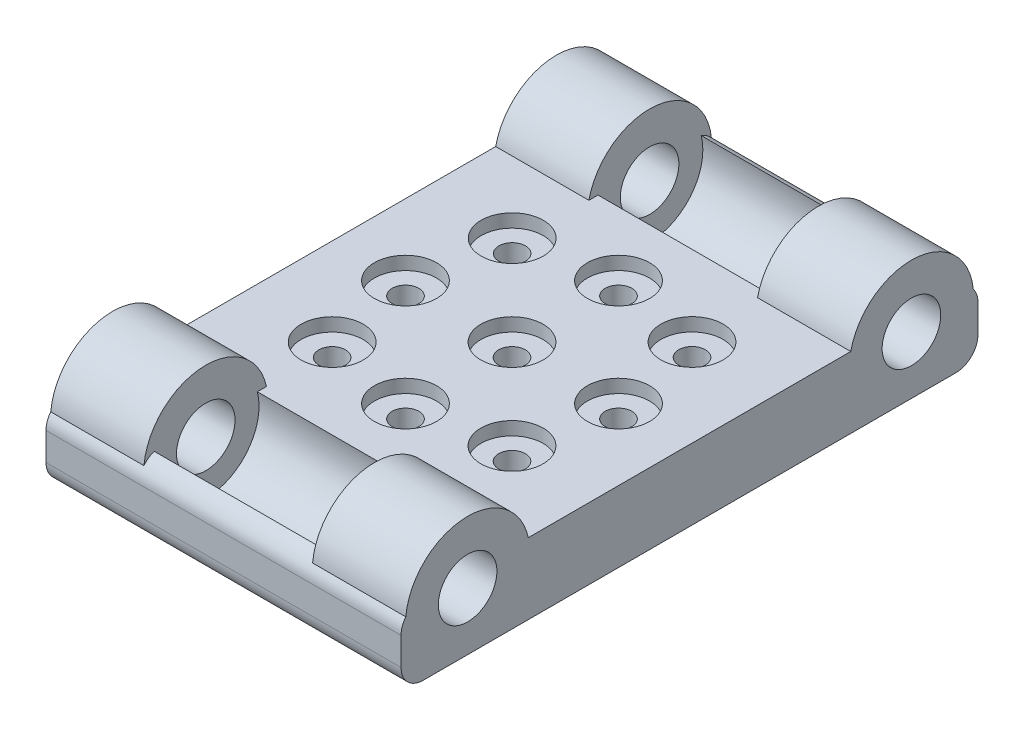
from build123d import *

# Parameters (mm, degrees)
SKETCH_1_W          = 40
SKETCH_1_H          = 65
EXTRUDE_1_DEPTH     = 8
SKETCH_5_R          = 6
CUT_EXTRUDE_2_DEPTH = 44
SKETCH_6_R          = 3.3
EXTRUDE_2_DEPTH     = 10.5
EXTRUDE_START       = -10.5
SKETCH_7_R          = 3.3
EXTRUDE_3_DEPTH     = 10.5
SKETCH_8_R          = 1.5
CUT_EXTRUDE_3_DEPTH = 10.5
FILLET_1_R          = 2.5
SKETCH_10_R         = 3
EXTRUDE_4_DEPTH     = 1
CHAMFER_1_SIZE      = 1.5
CHAMFER_1_SIZE_2    = 0.5
SKETCH_11_R         = 1.5
CUT_EXTRUDE_4_DEPTH = 22.5
SKETCH_12_R         = 3.5
CUT_EXTRUDE_5_DEPTH = 1.5


with BuildPart() as part:
    # 草图1 → 凸台-拉伸1 (new body)
    with BuildSketch(Plane(origin=(0, 0, 0), x_dir=(1, 0, 0), z_dir=(0, 1, 0))):
        with Locations((-1.467181467, -6.013513514)):
            Rectangle(SKETCH_1_W, SKETCH_1_H)
    extrude(amount=EXTRUDE_1_DEPTH)

    # 草图5 → 切除-拉伸2 (cut)
    with BuildSketch(Plane(origin=(18.532818533, 0, 0), x_dir=(0, 0, -1), z_dir=(1, 0, 0))):
        with Locations((18.986486486, 6.5)):
            Circle(SKETCH_5_R)
        with Locations((-31.013513514, 6.5)):
            Circle(SKETCH_5_R)
    extrude(amount=-CUT_EXTRUDE_2_DEPTH, mode=Mode.SUBTRACT)

    # 草图6 → 凸台-拉伸2 (add)
    # profile 1 of 3: a face of its own
    with BuildSketch(Plane(origin=(18.532818533, 0, 0), x_dir=(0, 0, -1), z_dir=(1, 0, 0))):
        with BuildLine():
            Line((16.388410275, 0), (21.584562698, 0))
            ThreePointArc((21.584562698, 0), (24.782456357, 2.574858823), (25.986486486, 6.5))
            ThreePointArc((25.986486486, 6.5), (25.945717053, 7.254393744), (25.823883652, 8))
            Line((25.823883652, 8), (24.795961506, 8))
            ThreePointArc((24.795961506, 8), (18.986486486, 0.5), (13.177011467, 8))
            Line((13.177011467, 8), (12.149089321, 8))
            ThreePointArc((12.149089321, 8), (12.801258967, 3.222354422), (16.388410275, 0))
        make_face()
    # profile 2 of 3: a face of its own
    with BuildSketch(Plane(origin=(18.532818533, 0, 0), x_dir=(0, 0, -1), z_dir=(1, 0, 0))):
        with BuildLine():
            ThreePointArc((25.823883652, 8), (18.986486486, 13.5), (12.149089321, 8))
            Line((12.149089321, 8), (13.177011467, 8))
            ThreePointArc((13.177011467, 8), (18.986486486, 0.5), (24.795961506, 8))
            Line((24.795961506, 8), (25.823883652, 8))
        make_face()
        with Locations((18.986486486, 6.5)):
            Circle(SKETCH_6_R, mode=Mode.SUBTRACT)
    # profile 3 of 3: a face of its own
    with BuildSketch(Plane(origin=(18.532818533, 0, 0), x_dir=(0, 0, -1), z_dir=(1, 0, 0))):
        with BuildLine():
            Line((-25.204038494, 8), (-24.176116348, 8))
            ThreePointArc((-24.176116348, 8), (-31.013513514, 13.5), (-37.850910679, 8))
            Line((-37.850910679, 8), (-36.822988533, 8))
            ThreePointArc((-36.822988533, 8), (-31.013513514, 0.5), (-25.204038494, 8))
        make_face()
        with Locations((-31.013513514, 6.5)):
            Circle(SKETCH_6_R, mode=Mode.SUBTRACT)
    extrude(amount=-EXTRUDE_2_DEPTH)

    # 草图7 → 凸台-拉伸3 (add)
    # profile 1 of 5: a face of its own
    with BuildSketch(Plane.ZY.offset(21.467181467).offset(EXTRUDE_START)):
        with BuildLine():
            ThreePointArc((37.850910679, 8), (31.013513514, 13.5), (24.176116348, 8))
            Line((24.176116348, 8), (25.204038494, 8))
            ThreePointArc((25.204038494, 8), (31.013513514, 0.5), (36.822988533, 8))
            Line((36.822988533, 8), (37.850910679, 8))
        make_face()
        with Locations(Location((31.013513514, 6.5, 0), (0, 0, 180))):
            Circle(SKETCH_7_R, mode=Mode.SUBTRACT)
    # profile 2 of 5: a face of its own
    with BuildSketch(Plane.ZY.offset(21.467181467).offset(EXTRUDE_START)):
        with BuildLine():
            Line((28.415437302, 0), (33.611589725, 0))
            ThreePointArc((33.611589725, 0), (36.809483384, 2.574858823), (38.013513514, 6.5))
            ThreePointArc((38.013513514, 6.5), (37.97274408, 7.254393744), (37.850910679, 8))
            Line((37.850910679, 8), (36.822988533, 8))
            ThreePointArc((36.822988533, 8), (31.013513514, 0.5), (25.204038494, 8))
            Line((25.204038494, 8), (24.176116348, 8))
            ThreePointArc((24.176116348, 8), (24.828285995, 3.222354422), (28.415437302, 0))
        make_face()
    # profile 3 of 5: a face of its own
    with BuildSketch(Plane.ZY.offset(21.467181467).offset(EXTRUDE_START)):
        with BuildLine():
            Line((-21.584562698, 0), (-16.388410275, 0))
            ThreePointArc((-16.388410275, 0), (-13.190516616, 2.574858823), (-11.986486486, 6.5))
            ThreePointArc((-11.986486486, 6.5), (-12.02725592, 7.254393744), (-12.149089321, 8))
            Line((-12.149089321, 8), (-13.177011467, 8))
            ThreePointArc((-13.177011467, 8), (-13.034308309, 7.256025755), (-12.986486486, 6.5))
            ThreePointArc((-12.986486486, 6.5), (-19.742512241, 0.547821822), (-24.795961506, 8))
            Line((-24.795961506, 8), (-25.823883652, 8))
            ThreePointArc((-25.823883652, 8), (-25.171714005, 3.222354422), (-21.584562698, 0))
        make_face()
    # profile 4 of 5: a face of its own
    with BuildSketch(Plane.ZY.offset(21.467181467).offset(EXTRUDE_START)):
        with BuildLine():
            ThreePointArc((-12.986486486, 6.5), (-13.034308309, 7.256025755), (-13.177011467, 8))
            ThreePointArc((-13.177011467, 8), (-18.986486486, 12.5), (-24.795961506, 8))
            ThreePointArc((-24.795961506, 8), (-19.742512241, 0.547821822), (-12.986486486, 6.5))
        make_face()
        with Locations(Location((-18.986486486, 6.5, 0), (0, 0, 180))):
            Circle(SKETCH_7_R, mode=Mode.SUBTRACT)
    # profile 5 of 5: a face of its own
    with BuildSketch(Plane.ZY.offset(21.467181467).offset(EXTRUDE_START)):
        with BuildLine():
            Line((-13.177011467, 8), (-12.149089321, 8))
            ThreePointArc((-12.149089321, 8), (-18.986486486, 13.5), (-25.823883652, 8))
            Line((-25.823883652, 8), (-24.795961506, 8))
            ThreePointArc((-24.795961506, 8), (-18.986486486, 12.5), (-13.177011467, 8))
        make_face()
    extrude(amount=EXTRUDE_3_DEPTH)

    # 草图8 → 切除-拉伸3 (cut)
    with BuildSketch(Plane.XZ):
        with Locations(Location((-1.467181467, 6.013513514, 0), (0, 0, 270))):
            Circle(SKETCH_8_R)
        with Locations(Location((-13.467181467, 6.013513514, 0), (0, 0, 270))):
            Circle(SKETCH_8_R)
        with Locations(Location((-1.467181467, 18.013513514, 0), (0, 0, 270))):
            Circle(SKETCH_8_R)
        with Locations(Location((10.532818533, 6.013513514, 0), (0, 0, 270))):
            Circle(SKETCH_8_R)
        with Locations(Location((-1.467181467, -5.986486486, 0), (0, 0, 270))):
            Circle(SKETCH_8_R)
    extrude(amount=-CUT_EXTRUDE_3_DEPTH, mode=Mode.SUBTRACT)

    # 圆角1
    # the kernel refuses this fillet: 2.5 mm, written as the material it takes off along each edge
    with BuildSketch(Plane(origin=(24.446124605, 8, 38.513513514), x_dir=(0, -1, 0), z_dir=(-1, 0, 0))) as fillet_1_piece_1_section:
        with BuildLine():
            CenterArc((2.365322429, -2.5), FILLET_1_R, 90, 71.107715915)
            Line((0, -1.690524981), (-0.047306449, -1.67433548))
            ThreePointArc((-0.047306449, -1.67433548), (-0.05, -0.84526249), (-0.05, 0))
            Line((-0.05, 0), (0, 0.05))
            Line((0, 0.05), (2.365322429, 0.05))
            Line((2.365322429, 0.05), (2.365322429, 0))
        make_face()
    fillet_1_piece_1 = extrude(amount=51.826612145, mode=Mode.PRIVATE)
    fillet_1_piece_1 = fillet_1_piece_1 - Plane(origin=(16.239471569, 6.5, 31.013513514), x_dir=(0, 0.21428571428570323, -0.976771023655527), z_dir=(1, 0, 0)) * Cylinder(7, 114, mode=Mode.PRIVATE)
    fillet_1_piece_1 = split(fillet_1_piece_1, bisect_by=Plane(origin=(8.032818533, 7.283309806, 38.299348366), z_dir=(1, 0, 0)), keep=Keep.TOP, mode=Mode.PRIVATE)
    add(fillet_1_piece_1, mode=Mode.SUBTRACT)
    with BuildSketch(Plane(origin=(24.446124605, 8, 38.513513514), x_dir=(0, -1, 0), z_dir=(-1, 0, 0))) as fillet_1_piece_2_section:
        with BuildLine():
            CenterArc((2.365322429, -2.5), FILLET_1_R, 90, 71.107715915)
            Line((0, -1.690524981), (-0.047306449, -1.67433548))
            ThreePointArc((-0.047306449, -1.67433548), (-0.05, -0.84526249), (-0.05, 0))
            Line((-0.05, 0), (0, 0.05))
            Line((0, 0.05), (2.365322429, 0.05))
            Line((2.365322429, 0.05), (2.365322429, 0))
        make_face()
    fillet_1_piece_2 = extrude(amount=51.826612145, mode=Mode.PRIVATE)
    fillet_1_piece_2 = fillet_1_piece_2 - Plane(origin=(-1.467181467, 6.5, 31.013513514), x_dir=(0, 0.21428571428570323, -0.976771023655527), z_dir=(1, 0, 0)) * Cylinder(7, 114, mode=Mode.PRIVATE)
    fillet_1_piece_2 = split(fillet_1_piece_2, bisect_by=Plane(origin=(8.032818533, 7.283309806, 38.299348366), z_dir=(-1, 0, 0)), keep=Keep.TOP, mode=Mode.PRIVATE)
    fillet_1_piece_2 = split(fillet_1_piece_2, bisect_by=Plane(origin=(-10.967181467, 7.283309806, 38.299348366), z_dir=(1, 0, 0)), keep=Keep.TOP, mode=Mode.PRIVATE)
    add(fillet_1_piece_2, mode=Mode.SUBTRACT)
    with BuildSketch(Plane(origin=(24.446124605, 8, 38.513513514), x_dir=(0, -1, 0), z_dir=(-1, 0, 0))) as fillet_1_piece_3_section:
        with BuildLine():
            CenterArc((2.365322429, -2.5), FILLET_1_R, 90, 71.107715915)
            Line((0, -1.690524981), (-0.047306449, -1.67433548))
            ThreePointArc((-0.047306449, -1.67433548), (-0.05, -0.84526249), (-0.05, 0))
            Line((-0.05, 0), (0, 0.05))
            Line((0, 0.05), (2.365322429, 0.05))
            Line((2.365322429, 0.05), (2.365322429, 0))
        make_face()
    fillet_1_piece_3 = extrude(amount=51.826612145, mode=Mode.PRIVATE)
    fillet_1_piece_3 = fillet_1_piece_3 & Plane(origin=(-1.467181467, 6.5, 31.013513514), x_dir=(0, 0.21428571428570323, -0.976771023655527), z_dir=(1, 0, 0)) * Cylinder(7, 114, mode=Mode.PRIVATE)
    fillet_1_piece_3 = split(fillet_1_piece_3, bisect_by=Plane(origin=(8.032818533, 7.788886654, 37.563279278), z_dir=(-1, 0, 0)), keep=Keep.TOP, mode=Mode.PRIVATE)
    fillet_1_piece_3 = split(fillet_1_piece_3, bisect_by=Plane(origin=(-10.967181467, 7.788886654, 37.563279278), z_dir=(1, 0, 0)), keep=Keep.TOP, mode=Mode.PRIVATE)
    add(fillet_1_piece_3, mode=Mode.SUBTRACT)
    with BuildSketch(Plane(origin=(24.446124605, 8, 38.513513514), x_dir=(0, -1, 0), z_dir=(-1, 0, 0))) as fillet_1_piece_4_section:
        with BuildLine():
            CenterArc((2.365322429, -2.5), FILLET_1_R, 90, 71.107715915)
            Line((0, -1.690524981), (-0.047306449, -1.67433548))
            ThreePointArc((-0.047306449, -1.67433548), (-0.05, -0.84526249), (-0.05, 0))
            Line((-0.05, 0), (0, 0.05))
            Line((0, 0.05), (2.365322429, 0.05))
            Line((2.365322429, 0.05), (2.365322429, 0))
        make_face()
    fillet_1_piece_4 = extrude(amount=51.826612145, mode=Mode.PRIVATE)
    fillet_1_piece_4 = fillet_1_piece_4 - Plane(origin=(-19.173834503, 6.5, 31.013513514), x_dir=(0, 0.21428571428570323, -0.976771023655527), z_dir=(1, 0, 0)) * Cylinder(7, 114, mode=Mode.PRIVATE)
    fillet_1_piece_4 = split(fillet_1_piece_4, bisect_by=Plane(origin=(-10.967181467, 7.283309806, 38.299348366), z_dir=(-1, 0, 0)), keep=Keep.TOP, mode=Mode.PRIVATE)
    add(fillet_1_piece_4, mode=Mode.SUBTRACT)
    with BuildSketch(Plane(origin=(-27.38048754, 8, -26.486486486), x_dir=(0, -1, 0), z_dir=(1, 0, 0))) as fillet_1_piece_5_section:
        with BuildLine():
            CenterArc((2.365322429, -2.5), FILLET_1_R, 90, 71.107715915)
            Line((0, -1.690524981), (-0.047306449, -1.67433548))
            ThreePointArc((-0.047306449, -1.67433548), (-0.05, -0.84526249), (-0.05, 0))
            Line((-0.05, 0), (0, 0.05))
            Line((0, 0.05), (2.365322429, 0.05))
            Line((2.365322429, 0.05), (2.365322429, 0))
        make_face()
    fillet_1_piece_5 = extrude(amount=51.826612145, mode=Mode.PRIVATE)
    fillet_1_piece_5 = fillet_1_piece_5 - Plane(origin=(-19.173834503, 6.5, -18.986486486), x_dir=(0, 0.21428571428572965, 0.9767710236555212), z_dir=(1, 0, 0)) * Cylinder(7, 114, mode=Mode.PRIVATE)
    fillet_1_piece_5 = split(fillet_1_piece_5, bisect_by=Plane(origin=(-10.967181467, 7.283309806, -26.272321339), z_dir=(-1, 0, 0)), keep=Keep.TOP, mode=Mode.PRIVATE)
    add(fillet_1_piece_5, mode=Mode.SUBTRACT)
    with BuildSketch(Plane(origin=(-27.38048754, 8, -26.486486486), x_dir=(0, -1, 0), z_dir=(1, 0, 0))) as fillet_1_piece_6_section:
        with BuildLine():
            CenterArc((2.365322429, -2.5), FILLET_1_R, 90, 71.107715915)
            Line((0, -1.690524981), (-0.047306449, -1.67433548))
            ThreePointArc((-0.047306449, -1.67433548), (-0.05, -0.84526249), (-0.05, 0))
            Line((-0.05, 0), (0, 0.05))
            Line((0, 0.05), (2.365322429, 0.05))
            Line((2.365322429, 0.05), (2.365322429, 0))
        make_face()
    fillet_1_piece_6 = extrude(amount=51.826612145, mode=Mode.PRIVATE)
    fillet_1_piece_6 = split(fillet_1_piece_6, bisect_by=Plane(origin=(8.032818533, 7.283309806, -26.272321339), z_dir=(-1, 0, 0)), keep=Keep.TOP, mode=Mode.PRIVATE)
    fillet_1_piece_6 = fillet_1_piece_6 - Plane(origin=(-1.467181467, 6.5, -18.986486486), x_dir=(0, 0.21428571428572965, 0.9767710236555212), z_dir=(1, 0, 0)) * Cylinder(7, 114, mode=Mode.PRIVATE)
    fillet_1_piece_6 = split(fillet_1_piece_6, bisect_by=Plane(origin=(-10.967181467, 7.283309806, -26.272321339), z_dir=(1, 0, 0)), keep=Keep.TOP, mode=Mode.PRIVATE)
    add(fillet_1_piece_6, mode=Mode.SUBTRACT)
    with BuildSketch(Plane(origin=(-27.38048754, 8, -26.486486486), x_dir=(0, -1, 0), z_dir=(1, 0, 0))) as fillet_1_piece_7_section:
        with BuildLine():
            CenterArc((2.365322429, -2.5), FILLET_1_R, 90, 71.107715915)
            Line((0, -1.690524981), (-0.047306449, -1.67433548))
            ThreePointArc((-0.047306449, -1.67433548), (-0.05, -0.84526249), (-0.05, 0))
            Line((-0.05, 0), (0, 0.05))
            Line((0, 0.05), (2.365322429, 0.05))
            Line((2.365322429, 0.05), (2.365322429, 0))
        make_face()
    fillet_1_piece_7 = extrude(amount=51.826612145, mode=Mode.PRIVATE)
    fillet_1_piece_7 = split(fillet_1_piece_7, bisect_by=Plane(origin=(8.032818533, 7.788886654, -25.536252251), z_dir=(-1, 0, 0)), keep=Keep.TOP, mode=Mode.PRIVATE)
    fillet_1_piece_7 = fillet_1_piece_7 & Plane(origin=(-1.467181467, 6.5, -18.986486486), x_dir=(0, 0.21428571428572965, 0.9767710236555212), z_dir=(1, 0, 0)) * Cylinder(7, 114, mode=Mode.PRIVATE)
    fillet_1_piece_7 = split(fillet_1_piece_7, bisect_by=Plane(origin=(-10.967181467, 7.788886654, -25.536252251), z_dir=(1, 0, 0)), keep=Keep.TOP, mode=Mode.PRIVATE)
    add(fillet_1_piece_7, mode=Mode.SUBTRACT)
    with BuildSketch(Plane(origin=(-27.38048754, 8, -26.486486486), x_dir=(0, -1, 0), z_dir=(1, 0, 0))) as fillet_1_piece_8_section:
        with BuildLine():
            CenterArc((2.365322429, -2.5), FILLET_1_R, 90, 71.107715915)
            Line((0, -1.690524981), (-0.047306449, -1.67433548))
            ThreePointArc((-0.047306449, -1.67433548), (-0.05, -0.84526249), (-0.05, 0))
            Line((-0.05, 0), (0, 0.05))
            Line((0, 0.05), (2.365322429, 0.05))
            Line((2.365322429, 0.05), (2.365322429, 0))
        make_face()
    fillet_1_piece_8 = extrude(amount=51.826612145, mode=Mode.PRIVATE)
    fillet_1_piece_8 = split(fillet_1_piece_8, bisect_by=Plane(origin=(8.032818533, 7.283309806, -26.272321339), z_dir=(1, 0, 0)), keep=Keep.TOP, mode=Mode.PRIVATE)
    fillet_1_piece_8 = fillet_1_piece_8 - Plane(origin=(16.239471569, 6.5, -18.986486486), x_dir=(0, 0.21428571428572965, 0.9767710236555212), z_dir=(1, 0, 0)) * Cylinder(7, 114, mode=Mode.PRIVATE)
    add(fillet_1_piece_8, mode=Mode.SUBTRACT)
    with BuildSketch(Plane(origin=(-27.717181467, 0, -26.486486486), x_dir=(0, 1, 0), z_dir=(1, 0, 0))) as fillet_1_piece_9:
        with BuildLine():
            CenterArc((FILLET_1_R, FILLET_1_R), FILLET_1_R, 180, 90)
            Line((0, FILLET_1_R), (-FILLET_1_R * 0.02, FILLET_1_R))
            Line((-FILLET_1_R * 0.02, FILLET_1_R), (-FILLET_1_R * 0.02, -FILLET_1_R * 0.02))
            Line((-FILLET_1_R * 0.02, -FILLET_1_R * 0.02), (FILLET_1_R, -FILLET_1_R * 0.02))
            Line((FILLET_1_R, -FILLET_1_R * 0.02), (FILLET_1_R, 0))
        make_face()
    extrude(amount=52.5, mode=Mode.SUBTRACT)
    with BuildSketch(Plane(origin=(24.782818533, 0, 38.513513514), x_dir=(0, 0, -1), z_dir=(-1, 0, 0))) as fillet_1_piece_10:
        with BuildLine():
            CenterArc((FILLET_1_R, -FILLET_1_R), FILLET_1_R, 90, 90)
            Line((0, -FILLET_1_R), (-FILLET_1_R * 0.02, -FILLET_1_R))
            Line((-FILLET_1_R * 0.02, -FILLET_1_R), (-FILLET_1_R * 0.02, FILLET_1_R * 0.02))
            Line((-FILLET_1_R * 0.02, FILLET_1_R * 0.02), (FILLET_1_R, FILLET_1_R * 0.02))
            Line((FILLET_1_R, FILLET_1_R * 0.02), (FILLET_1_R, 0))
        make_face()
    extrude(amount=52.5, mode=Mode.SUBTRACT)

    # 草图10 → 凸台-拉伸4 (add)
    with BuildSketch(Plane(origin=(0, 0, 0), x_dir=(-1, 0, 0), z_dir=(0, -1, 0))):
        with Locations(Location((-8.662818533, 4.136486486, 0), (0, 0, 270))):
            Circle(SKETCH_10_R)
        with Locations(Location((11.597181467, 4.136486486, 0), (0, 0, 270))):
            Circle(SKETCH_10_R)
        with Locations(Location((-8.662818533, -16.143513514, 0), (0, 0, 270))):
            Circle(SKETCH_10_R)
        with Locations(Location((11.597181467, -16.143513514, 0), (0, 0, 270))):
            Circle(SKETCH_10_R)
    extrude(amount=EXTRUDE_4_DEPTH)

    # 倒角1
    # the kernel refuses this chamfer: 1.5, 0.5 mm, written as the material it takes off along each edge
    with BuildSketch(Plane(origin=(8.662818533, -1, 16.143513514), x_dir=(0, 0, 1), z_dir=(1, 0, 0))) as chamfer_1_piece_1_section:
        Polygon((3, -CHAMFER_1_SIZE), (3 - CHAMFER_1_SIZE_2, 0), (3, 0), align=None)
    chamfer_1_piece_1 = revolve(axis=Axis((8.662818533, -1, 16.143513514), (0, -1, 0)), mode=Mode.PRIVATE)
    chamfer_1_piece_1 = split(chamfer_1_piece_1, bisect_by=Plane(origin=(8.662818533, 0, 13.468359413), z_dir=(0, -1, 0)), keep=Keep.TOP, mode=Mode.PRIVATE)
    add(chamfer_1_piece_1, mode=Mode.SUBTRACT)
    with BuildSketch(Plane(origin=(8.662818533, -1, -4.136486486), x_dir=(0, 0, 1), z_dir=(1, 0, 0))) as chamfer_1_piece_2_section:
        Polygon((3, -CHAMFER_1_SIZE), (3 - CHAMFER_1_SIZE_2, 0), (3, 0), align=None)
    chamfer_1_piece_2 = revolve(axis=Axis((8.662818533, -1, -4.136486486), (0, -1, 0)), mode=Mode.PRIVATE)
    chamfer_1_piece_2 = split(chamfer_1_piece_2, bisect_by=Plane(origin=(8.662818533, 0, -6.811640587), z_dir=(0, -1, 0)), keep=Keep.TOP, mode=Mode.PRIVATE)
    add(chamfer_1_piece_2, mode=Mode.SUBTRACT)
    with BuildSketch(Plane(origin=(-11.597181467, -1, 16.143513514), x_dir=(0, 0, 1), z_dir=(1, 0, 0))) as chamfer_1_piece_3_section:
        Polygon((3, -CHAMFER_1_SIZE), (3 - CHAMFER_1_SIZE_2, 0), (3, 0), align=None)
    chamfer_1_piece_3 = revolve(axis=Axis((-11.597181467, -1, 16.143513514), (0, -1, 0)), mode=Mode.PRIVATE)
    chamfer_1_piece_3 = split(chamfer_1_piece_3, bisect_by=Plane(origin=(-11.597181467, 0, 13.468359413), z_dir=(0, -1, 0)), keep=Keep.TOP, mode=Mode.PRIVATE)
    add(chamfer_1_piece_3, mode=Mode.SUBTRACT)
    with BuildSketch(Plane(origin=(-11.597181467, -1, -4.136486486), x_dir=(0, 0, 1), z_dir=(1, 0, 0))) as chamfer_1_piece_4_section:
        Polygon((3, -CHAMFER_1_SIZE), (3 - CHAMFER_1_SIZE_2, 0), (3, 0), align=None)
    chamfer_1_piece_4 = revolve(axis=Axis((-11.597181467, -1, -4.136486486), (0, -1, 0)), mode=Mode.PRIVATE)
    chamfer_1_piece_4 = split(chamfer_1_piece_4, bisect_by=Plane(origin=(-11.597181467, 0, -6.811640587), z_dir=(0, -1, 0)), keep=Keep.TOP, mode=Mode.PRIVATE)
    add(chamfer_1_piece_4, mode=Mode.SUBTRACT)

    # 草图11 → 切除-拉伸4 (cut)
    with BuildSketch(Plane.XZ.offset(1)):
        with Locations(Location((-11.597181467, -4.136486486, 0), (0, 0, 270))):
            Circle(SKETCH_11_R)
        with Locations(Location((-11.597181467, 16.143513514, 0), (0, 0, 270))):
            Circle(SKETCH_11_R)
        with Locations(Location((8.662818533, 16.143513514, 0), (0, 0, 270))):
            Circle(SKETCH_11_R)
        with Locations(Location((8.662818533, -4.136486486, 0), (0, 0, 270))):
            Circle(SKETCH_11_R)
    extrude(amount=-CUT_EXTRUDE_4_DEPTH, mode=Mode.SUBTRACT)

    # 草图12 → 切除-拉伸5 (cut)
    with BuildSketch(Plane(origin=(0, 8, 0), x_dir=(1, 0, 0), z_dir=(0, 1, 0))):
        with Locations(Location((8.662818533, 4.136486486, 0), (0, 0, 270))):
            Circle(SKETCH_12_R)
        with Locations(Location((10.532818533, -6.013513514, 0), (0, 0, 270))):
            Circle(SKETCH_12_R)
        with Locations(Location((8.662818533, -16.143513514, 0), (0, 0, 270))):
            Circle(SKETCH_12_R)
        with Locations(Location((-1.467181467, 5.986486486, 0), (0, 0, 270))):
            Circle(SKETCH_12_R)
        with Locations(Location((-1.467181467, -6.013513514, 0), (0, 0, 270))):
            Circle(SKETCH_12_R)
        with Locations(Location((-1.467181467, -18.013513514, 0), (0, 0, 270))):
            Circle(SKETCH_12_R)
        with Locations(Location((-11.597181467, -16.143513514, 0), (0, 0, 270))):
            Circle(SKETCH_12_R)
        with Locations(Location((-13.467181467, -6.013513514, 0), (0, 0, 270))):
            Circle(SKETCH_12_R)
        with Locations(Location((-11.597181467, 4.136486486, 0), (0, 0, 270))):
            Circle(SKETCH_12_R)
    extrude(amount=-CUT_EXTRUDE_5_DEPTH, mode=Mode.SUBTRACT)


solid = part.part
